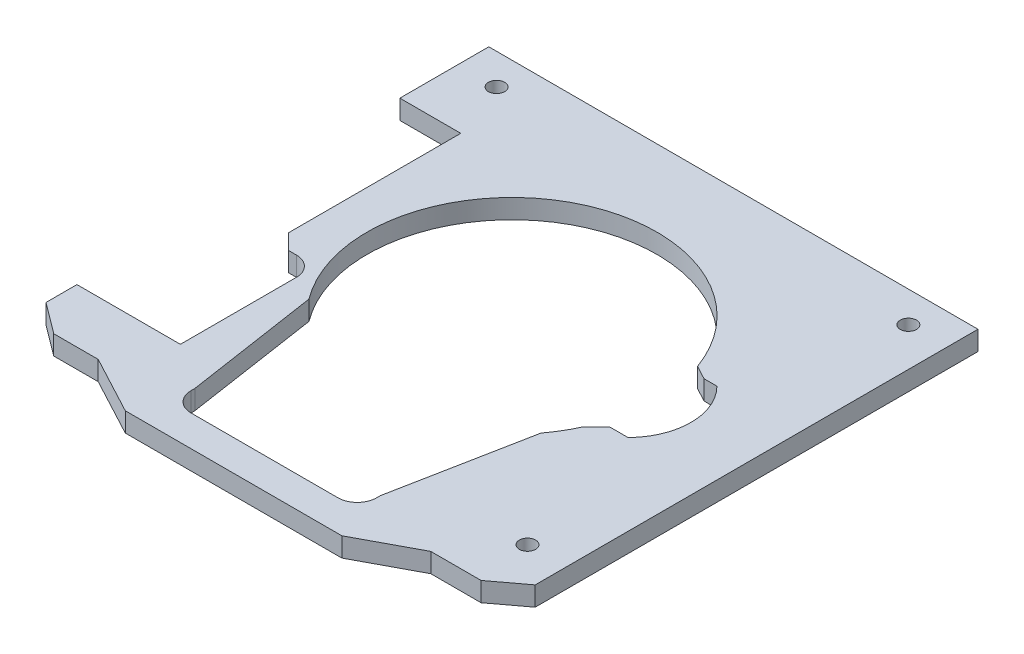
from build123d import *

# Parameters (mm, degrees)
SKETCH_1_R       = 2.1
EXTRUDE_3_DEPTH  = 5
FILLET_1_R       = 5
CHAMFER_1_SIZE   = 2
CHAMFER_1_SIZE_2 = 2.97860662
CHAMFER_2_SIZE   = 4


with BuildPart() as part:
    # Эскиз1 → Бобышка-Вытянуть3 (new body)
    # profile 1 of 4: a face of its own
    with BuildSketch(Plane(origin=(0, 249.195974268, 0), x_dir=(1, 0, 0), z_dir=(0, 1, 0))):
        with BuildLine():
            ThreePointArc((100.251716198, -101.773129836), (97.92926953, -107.109956368), (94.808980694, -112.023129836))
            Line((94.808980694, -112.023129836), (88.058980694, -146.773129836))
            Line((88.058980694, -146.773129836), (100.251716198, -146.773129836))
            Line((100.251716198, -146.773129836), (100.251716198, -101.773129836))
        make_face()
    # profile 2 of 4: a face of its own
    with BuildSketch(Plane(origin=(0, 249.195974268, 0), x_dir=(1, 0, 0), z_dir=(0, 1, 0))):
        with BuildLine():
            Line((1.558980694, -138.773129836), (1.558980694, -146.773129836))
            Line((1.558980694, -146.773129836), (40.058980694, -146.773129836))
            Line((40.058980694, -146.773129836), (34.808980694, -112.023129836))
            ThreePointArc((34.808980694, -112.023129836), (28.511671278, -80.102125156), (49.53850264, -55.273129836))
            ThreePointArc((49.53850264, -55.273129836), (64.808980694, -52.023129836), (80.079458748, -55.273129836))
            ThreePointArc((80.079458748, -55.273129836), (92.976106795, -64.767059728), (100.735907579, -78.775761573))
            Line((100.735907579, -78.775761573), (100.735907579, -32.273129836))
            Line((100.735907579, -32.273129836), (1.558980694, -32.273129836))
            Line((1.558980694, -32.273129836), (1.558980694, -55.273129836))
            Line((1.558980694, -55.273129836), (17.308980694, -55.273129836))
            Line((17.308980694, -55.273129836), (17.308980694, -89.523129836))
            Line((17.308980694, -89.523129836), (17.308980694, -103.773129836))
            Line((17.308980694, -103.773129836), (28.308980694, -103.773129836))
            Line((28.308980694, -103.773129836), (28.308980694, -138.773129836))
            Line((28.308980694, -138.773129836), (1.558980694, -138.773129836))
        make_face()
        with Locations(Location((11.55898069, -40.273129836, 0), (0, 0, 180))):
            Circle(SKETCH_1_R, mode=Mode.SUBTRACT)
    # profile 3 of 4: a face of its own
    with BuildSketch(Plane(origin=(0, 249.195974268, 0), x_dir=(1, 0, 0), z_dir=(0, 1, 0))):
        Polygon((88.058980694, -160.773129836), (40.058980694, -160.773129836), (36.058980694, -160.773129836), (21.058980694, -152.773129836), (9.558980694, -152.773129836), (1.558980694, -146.773129836), (40.058980694, -146.773129836), (40.058980694, -152.773129836), (88.058980694, -152.773129836), align=None)
    # profile 4 of 4: a face of its own
    with BuildSketch(Plane(origin=(0, 249.195974268, 0), x_dir=(1, 0, 0), z_dir=(0, 1, 0))):
        with BuildLine():
            Line((88.058980694, -146.773129836), (88.058980694, -152.773129836))
            Line((88.058980694, -152.773129836), (88.058980694, -160.773129836))
            Line((88.058980694, -160.773129836), (92.058980694, -160.773129836))
            Line((92.058980694, -160.773129836), (107.058980694, -152.773129836))
            Line((107.058980694, -152.773129836), (120.058980694, -152.773129836))
            Line((120.058980694, -152.773129836), (128.058980694, -146.773129836))
            Line((128.058980694, -146.773129836), (128.058980694, -55.273129836))
            Line((128.058980694, -55.273129836), (128.058980694, -32.273129836))
            Line((128.058980694, -32.273129836), (107.058980694, -32.273129836))
            Line((107.058980694, -32.273129836), (100.735907579, -32.273129836))
            Line((100.735907579, -32.273129836), (100.735907579, -78.775761573))
            Line((100.735907579, -78.775761573), (107.058980694, -78.775761573))
            ThreePointArc((107.058980694, -78.775761573), (111.821891611, -90.274445705), (107.058980694, -101.773129836))
            Line((107.058980694, -101.773129836), (100.251716198, -101.773129836))
            Line((100.251716198, -101.773129836), (100.251716198, -146.773129836))
            Line((100.251716198, -146.773129836), (88.058980694, -146.773129836))
        make_face()
        with Locations(Location((118.058980694, -138.773129836, 0), (0, 0, 180))):
            Circle(SKETCH_1_R, mode=Mode.SUBTRACT)
        with Locations(Location((118.058980694, -40.273129836, 0), (0, 0, 180))):
            Circle(SKETCH_1_R, mode=Mode.SUBTRACT)
    extrude(amount=EXTRUDE_3_DEPTH)

    # Скругление1
    fillet_1_edges = [part.edges().sort_by_distance(p)[0] for p in [
        (28.308980694, 251.695974268, 103.773129836),
        (40.058980694, 251.695974268, 152.773129836),
        (88.058980694, 251.695974268, 152.773129836),
    ]]
    fillet(fillet_1_edges, radius=FILLET_1_R)

    # Фаска1
    # the kernel refuses this chamfer: 3.233771195, 2.97860662, 2 mm, written as the material it takes off along each edge
    with BuildSketch(Plane(origin=(100.251716198, 239.918924652, 101.773129836), x_dir=(-0.3715523502271027, -3.437549783964329e-15, 0.9284120050067838), z_dir=(0, 1, 0))) as chamfer_1_piece_1:
        with BuildLine():
            Line((3.591569227, 0), (-CHAMFER_1_SIZE * 0.371552350227, CHAMFER_1_SIZE * 0.928412005007))
            Line((-CHAMFER_1_SIZE * 0.371552350227, CHAMFER_1_SIZE * 0.928412005007), (0, 0))
            ThreePointArc((0, 0), (1.855343846, 0.04297528), (3.591569227, 0))
        make_face()
    extrude(amount=23.554099231, mode=Mode.SUBTRACT)
    with BuildSketch(Plane(origin=(100.735907579, 241.48601373, 78.775761573), x_dir=(-0.31276738664383585, -2.8936796166985435e-15, -0.9498297541412279), z_dir=(0, 1, 0))) as chamfer_1_piece_2:
        with BuildLine():
            Line((2.057201754, 0), (-CHAMFER_1_SIZE_2 * 0.312767386639, -CHAMFER_1_SIZE_2 * 0.949829754125))
            Line((-CHAMFER_1_SIZE_2 * 0.312767386639, -CHAMFER_1_SIZE_2 * 0.949829754125), (0, 0))
            ThreePointArc((0, 0), (1.071927906, -0.014084555), (2.057201754, 0))
        make_face()
    extrude(amount=20.419921076, mode=Mode.SUBTRACT)

    # Фаска2
    chamfer_2_edges = [part.edges().sort_by_distance(p)[0] for p in [
        (17.308980694, 251.695974268, 103.773129836),
    ]]
    chamfer(chamfer_2_edges, length=CHAMFER_2_SIZE)


solid = part.part
